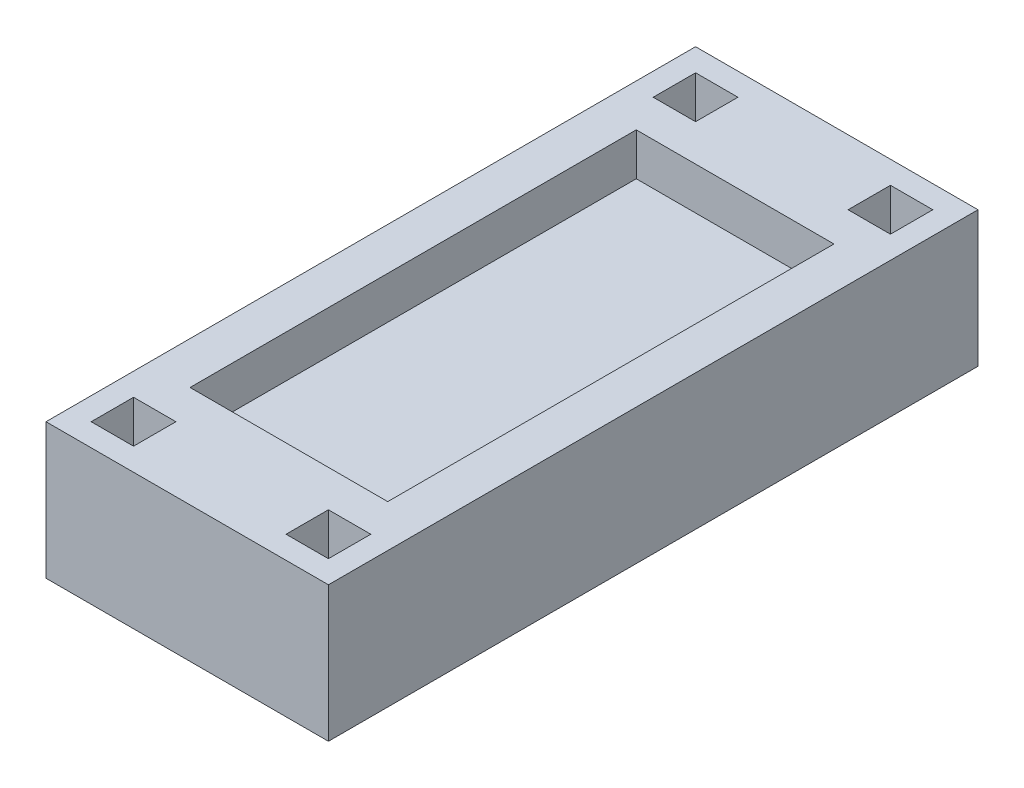
from build123d import *

# Parameters (mm, degrees)
SKETCH1_W           = 20
SKETCH1_H           = 42
BOSS_EXTRUDE1_DEPTH = 7.6
CUT_EXTRUDE1_DEPTH  = 4
THICKEN1_START      = -10
THICKEN1_DEPTH      = 20
SKETCH3_R           = 3.25
CUT_EXTRUDE2_DEPTH  = 1.6
SKETCH5_W           = 3
SKETCH5_H           = 3
CUT_EXTRUDE4_DEPTH  = 7
SKETCH6_W           = 14
SKETCH6_H           = 31.6
CUT_EXTRUDE5_DEPTH  = 3


# Read off the part's stored shape, not the designer's step: Thicken1
with BuildPart() as part:
    # Sketch1 → Boss-Extrude1 (new body)
    with BuildSketch(Plane(origin=(0, 0, 0), x_dir=(1, 0, 0), z_dir=(0, 1, 0))):
        Rectangle(SKETCH1_W, SKETCH1_H)
    extrude(amount=BOSS_EXTRUDE1_DEPTH)

    # Sketch2 → Cut-Extrude1 (cut)
    with BuildSketch(Plane.XZ):
        with BuildLine():
            Line((5.5, 2), (8.5, 2))
            Line((8.5, 2), (8.5, -2))
            Line((8.5, -2), (5.5, -2))
            ThreePointArc((5.5, -2), (4.085786438, -2.585786438), (3.5, -4))
            Line((3.5, -4), (3.5, -17.5))
            Line((3.5, -17.5), (-3.5, -17.5))
            Line((-3.5, -17.5), (-3.5, -4))
            ThreePointArc((-3.5, -4), (-4.085786438, -2.585786438), (-5.5, -2))
            Line((-5.5, -2), (-8.5, -2))
            Line((-8.5, -2), (-8.5, 2))
            Line((-8.5, 2), (-5.5, 2))
            ThreePointArc((-5.5, 2), (-4.085786438, 2.585786438), (-3.5, 4))
            Line((-3.5, 4), (-3.5, 17.5))
            Line((-3.5, 17.5), (3.5, 17.5))
            Line((3.5, 17.5), (3.5, 4))
            ThreePointArc((3.5, 4), (4.085786438, 2.585786438), (5.5, 2))
        make_face()
    extrude(amount=-CUT_EXTRUDE1_DEPTH, mode=Mode.SUBTRACT)

    # Thicken1 outline → Thicken1 (add)
    with BuildSketch(Plane.YZ.offset(THICKEN1_START)):
        Polygon((0, -23), (9.6, -23), (9.6, 23), (0, 23), (0, 21), (7.6, 21), (7.6, -21), (0, -21), align=None)
    extrude(amount=THICKEN1_DEPTH)

    # Sketch3 → Cut-Extrude2 (cut)
    with BuildSketch(Plane.XZ.offset(-4)):
        with Locations(Location((0, 11.5, 0), (0, 0, 270))):
            Circle(SKETCH3_R)
        with Locations(Location((0, -11.5, 0), (0, 0, 90))):
            Circle(SKETCH3_R)
    extrude(amount=-CUT_EXTRUDE2_DEPTH, mode=Mode.SUBTRACT)

    # Sketch5 → Cut-Extrude4 (cut)
    with BuildSketch(Plane(origin=(0, 9.6, 0), x_dir=(1, 0, 0), z_dir=(0, 1, 0))):
        with Locations((-6.9, 19.9)):
            Rectangle(SKETCH5_W, SKETCH5_H)
        with Locations((6.9, 19.9)):
            Rectangle(SKETCH5_W, SKETCH5_H)
        with Locations((6.9, -19.9)):
            Rectangle(SKETCH5_W, SKETCH5_H)
        with Locations((-6.9, -19.9)):
            Rectangle(SKETCH5_W, SKETCH5_H)
    extrude(amount=-CUT_EXTRUDE4_DEPTH, mode=Mode.SUBTRACT)

    # Sketch6 → Cut-Extrude5 (cut)
    with BuildSketch(Plane(origin=(0, 9.6, 0), x_dir=(1, 0, 0), z_dir=(0, 1, 0))):
        Rectangle(SKETCH6_W, SKETCH6_H)
    extrude(amount=-CUT_EXTRUDE5_DEPTH, mode=Mode.SUBTRACT)


solid = part.part
